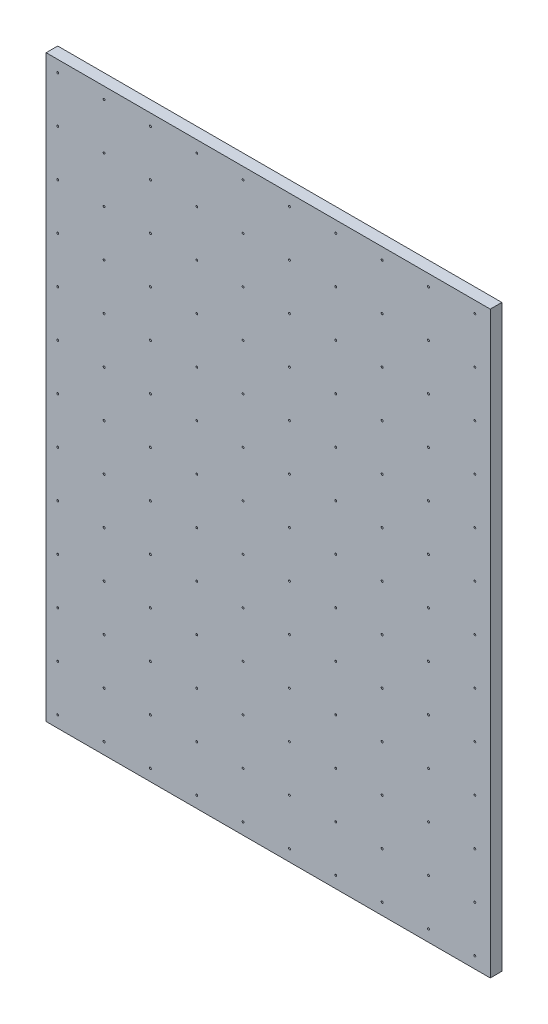
from build123d import *

# Parameters (mm, degrees)
SKETCH_1_W          = 1150
SKETCH_1_H          = 1500
EXTRUDE_1_DEPTH     = 15
SKETCH_2_R          = 2.5
CUT_EXTRUDE_1_DEPTH = 946.528952492


with BuildPart() as part:
    # Эскиз1 → Бобышка-Вытянуть1 (new, symmetric)
    with BuildSketch(Plane.XY):
        Rectangle(SKETCH_1_W, SKETCH_1_H)
    extrude(amount=EXTRUDE_1_DEPTH, both=True)

    # Эскиз2 → Вырез-Вытянуть1 (cut, through all)
    with BuildSketch(Plane.XY.offset(15)):
        with Locations((-545, 720)):
            Circle(SKETCH_2_R)
        with Locations((-425, 720)):
            Circle(SKETCH_2_R)
        with Locations((-305, 720)):
            Circle(SKETCH_2_R)
        with Locations((-185, 720)):
            Circle(SKETCH_2_R)
        with Locations((-65, 720)):
            Circle(SKETCH_2_R)
        with Locations((55, 720)):
            Circle(SKETCH_2_R)
        with Locations((175, 720)):
            Circle(SKETCH_2_R)
        with Locations((295, 720)):
            Circle(SKETCH_2_R)
        with Locations((415, 720)):
            Circle(SKETCH_2_R)
        with Locations((535, 720)):
            Circle(SKETCH_2_R)
        with Locations((-425, 600)):
            Circle(SKETCH_2_R)
        with Locations((-305, 600)):
            Circle(SKETCH_2_R)
        with Locations((-185, 600)):
            Circle(SKETCH_2_R)
        with Locations((-65, 600)):
            Circle(SKETCH_2_R)
        with Locations((55, 600)):
            Circle(SKETCH_2_R)
        with Locations((175, 600)):
            Circle(SKETCH_2_R)
        with Locations((295, 600)):
            Circle(SKETCH_2_R)
        with Locations((415, 600)):
            Circle(SKETCH_2_R)
        with Locations((535, 600)):
            Circle(SKETCH_2_R)
        with Locations((-425, 480)):
            Circle(SKETCH_2_R)
        with Locations((-305, 480)):
            Circle(SKETCH_2_R)
        with Locations((-185, 480)):
            Circle(SKETCH_2_R)
        with Locations((-65, 480)):
            Circle(SKETCH_2_R)
        with Locations((55, 480)):
            Circle(SKETCH_2_R)
        with Locations((175, 480)):
            Circle(SKETCH_2_R)
        with Locations((295, 480)):
            Circle(SKETCH_2_R)
        with Locations((415, 480)):
            Circle(SKETCH_2_R)
        with Locations((535, 480)):
            Circle(SKETCH_2_R)
        with Locations((-425, 360)):
            Circle(SKETCH_2_R)
        with Locations((-305, 360)):
            Circle(SKETCH_2_R)
        with Locations((-185, 360)):
            Circle(SKETCH_2_R)
        with Locations((-65, 360)):
            Circle(SKETCH_2_R)
        with Locations((55, 360)):
            Circle(SKETCH_2_R)
        with Locations((175, 360)):
            Circle(SKETCH_2_R)
        with Locations((295, 360)):
            Circle(SKETCH_2_R)
        with Locations((415, 360)):
            Circle(SKETCH_2_R)
        with Locations((535, 360)):
            Circle(SKETCH_2_R)
        with Locations((-425, 240)):
            Circle(SKETCH_2_R)
        with Locations((-305, 240)):
            Circle(SKETCH_2_R)
        with Locations((-185, 240)):
            Circle(SKETCH_2_R)
        with Locations((-65, 240)):
            Circle(SKETCH_2_R)
        with Locations((55, 240)):
            Circle(SKETCH_2_R)
        with Locations((175, 240)):
            Circle(SKETCH_2_R)
        with Locations((295, 240)):
            Circle(SKETCH_2_R)
        with Locations((415, 240)):
            Circle(SKETCH_2_R)
        with Locations((535, 240)):
            Circle(SKETCH_2_R)
        with Locations((-425, 120)):
            Circle(SKETCH_2_R)
        with Locations((-305, 120)):
            Circle(SKETCH_2_R)
        with Locations((-185, 120)):
            Circle(SKETCH_2_R)
        with Locations((-65, 120)):
            Circle(SKETCH_2_R)
        with Locations((55, 120)):
            Circle(SKETCH_2_R)
        with Locations((175, 120)):
            Circle(SKETCH_2_R)
        with Locations((295, 120)):
            Circle(SKETCH_2_R)
        with Locations((415, 120)):
            Circle(SKETCH_2_R)
        with Locations((535, 120)):
            Circle(SKETCH_2_R)
        with Locations((-425, 0)):
            Circle(SKETCH_2_R)
        with Locations((-305, 0)):
            Circle(SKETCH_2_R)
        with Locations((-185, 0)):
            Circle(SKETCH_2_R)
        with Locations((-65, 0)):
            Circle(SKETCH_2_R)
        with Locations((55, 0)):
            Circle(SKETCH_2_R)
        with Locations((175, 0)):
            Circle(SKETCH_2_R)
        with Locations((295, 0)):
            Circle(SKETCH_2_R)
        with Locations((415, 0)):
            Circle(SKETCH_2_R)
        with Locations((535, 0)):
            Circle(SKETCH_2_R)
        with Locations((-425, -120)):
            Circle(SKETCH_2_R)
        with Locations((-305, -120)):
            Circle(SKETCH_2_R)
        with Locations((-185, -120)):
            Circle(SKETCH_2_R)
        with Locations((-65, -120)):
            Circle(SKETCH_2_R)
        with Locations((55, -120)):
            Circle(SKETCH_2_R)
        with Locations((175, -120)):
            Circle(SKETCH_2_R)
        with Locations((295, -120)):
            Circle(SKETCH_2_R)
        with Locations((415, -120)):
            Circle(SKETCH_2_R)
        with Locations((535, -120)):
            Circle(SKETCH_2_R)
        with Locations((-425, -240)):
            Circle(SKETCH_2_R)
        with Locations((-305, -240)):
            Circle(SKETCH_2_R)
        with Locations((-185, -240)):
            Circle(SKETCH_2_R)
        with Locations((-65, -240)):
            Circle(SKETCH_2_R)
        with Locations((55, -240)):
            Circle(SKETCH_2_R)
        with Locations((175, -240)):
            Circle(SKETCH_2_R)
        with Locations((295, -240)):
            Circle(SKETCH_2_R)
        with Locations((415, -240)):
            Circle(SKETCH_2_R)
        with Locations((535, -240)):
            Circle(SKETCH_2_R)
        with Locations((-425, -360)):
            Circle(SKETCH_2_R)
        with Locations((-305, -360)):
            Circle(SKETCH_2_R)
        with Locations((-185, -360)):
            Circle(SKETCH_2_R)
        with Locations((-65, -360)):
            Circle(SKETCH_2_R)
        with Locations((55, -360)):
            Circle(SKETCH_2_R)
        with Locations((175, -360)):
            Circle(SKETCH_2_R)
        with Locations((295, -360)):
            Circle(SKETCH_2_R)
        with Locations((415, -360)):
            Circle(SKETCH_2_R)
        with Locations((535, -360)):
            Circle(SKETCH_2_R)
        with Locations((-425, -480)):
            Circle(SKETCH_2_R)
        with Locations((-305, -480)):
            Circle(SKETCH_2_R)
        with Locations((-185, -480)):
            Circle(SKETCH_2_R)
        with Locations((-65, -480)):
            Circle(SKETCH_2_R)
        with Locations((55, -480)):
            Circle(SKETCH_2_R)
        with Locations((175, -480)):
            Circle(SKETCH_2_R)
        with Locations((295, -480)):
            Circle(SKETCH_2_R)
        with Locations((415, -480)):
            Circle(SKETCH_2_R)
        with Locations((535, -480)):
            Circle(SKETCH_2_R)
        with Locations((-425, -600)):
            Circle(SKETCH_2_R)
        with Locations((-305, -600)):
            Circle(SKETCH_2_R)
        with Locations((-185, -600)):
            Circle(SKETCH_2_R)
        with Locations((-65, -600)):
            Circle(SKETCH_2_R)
        with Locations((55, -600)):
            Circle(SKETCH_2_R)
        with Locations((175, -600)):
            Circle(SKETCH_2_R)
        with Locations((295, -600)):
            Circle(SKETCH_2_R)
        with Locations((415, -600)):
            Circle(SKETCH_2_R)
        with Locations((535, -600)):
            Circle(SKETCH_2_R)
        with Locations((-425, -720)):
            Circle(SKETCH_2_R)
        with Locations((-305, -720)):
            Circle(SKETCH_2_R)
        with Locations((-185, -720)):
            Circle(SKETCH_2_R)
        with Locations((-65, -720)):
            Circle(SKETCH_2_R)
        with Locations((55, -720)):
            Circle(SKETCH_2_R)
        with Locations((175, -720)):
            Circle(SKETCH_2_R)
        with Locations((295, -720)):
            Circle(SKETCH_2_R)
        with Locations((415, -720)):
            Circle(SKETCH_2_R)
        with Locations((535, -720)):
            Circle(SKETCH_2_R)
        with Locations((-545, 600)):
            Circle(SKETCH_2_R)
        with Locations((-545, 480)):
            Circle(SKETCH_2_R)
        with Locations((-545, 360)):
            Circle(SKETCH_2_R)
        with Locations((-545, 240)):
            Circle(SKETCH_2_R)
        with Locations((-545, 120)):
            Circle(SKETCH_2_R)
        with Locations((-545, 0)):
            Circle(SKETCH_2_R)
        with Locations((-545, -120)):
            Circle(SKETCH_2_R)
        with Locations((-545, -240)):
            Circle(SKETCH_2_R)
        with Locations((-545, -360)):
            Circle(SKETCH_2_R)
        with Locations((-545, -480)):
            Circle(SKETCH_2_R)
        with Locations((-545, -600)):
            Circle(SKETCH_2_R)
        with Locations((-545, -720)):
            Circle(SKETCH_2_R)
    extrude(amount=-CUT_EXTRUDE_1_DEPTH, mode=Mode.SUBTRACT)


solid = part.part
